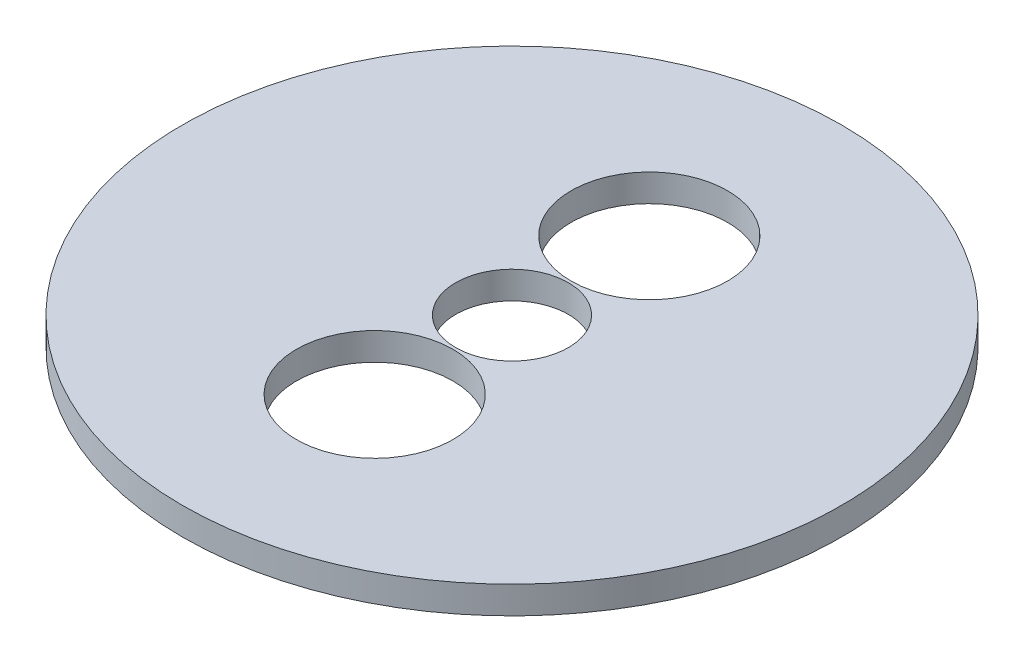
from build123d import *

# Parameters (mm, degrees)
SKETCH1_R           = 1200
SKETCH1_R_2         = 285
SKETCH1_R_3         = 205
BOSS_EXTRUDE1_DEPTH = 100


with BuildPart() as part:
    # Sketch1 → Boss-Extrude1 (new body)
    with BuildSketch(Plane(origin=(0, 0, 0), x_dir=(1, 0, 0), z_dir=(0, 1, 0))):
        Circle(SKETCH1_R)
        with Locations((0, 500)):
            Circle(SKETCH1_R_2, mode=Mode.SUBTRACT)
        Circle(SKETCH1_R_3, mode=Mode.SUBTRACT)
        with Locations((0, -500)):
            Circle(SKETCH1_R_2, mode=Mode.SUBTRACT)
    extrude(amount=BOSS_EXTRUDE1_DEPTH)


solid = part.part
